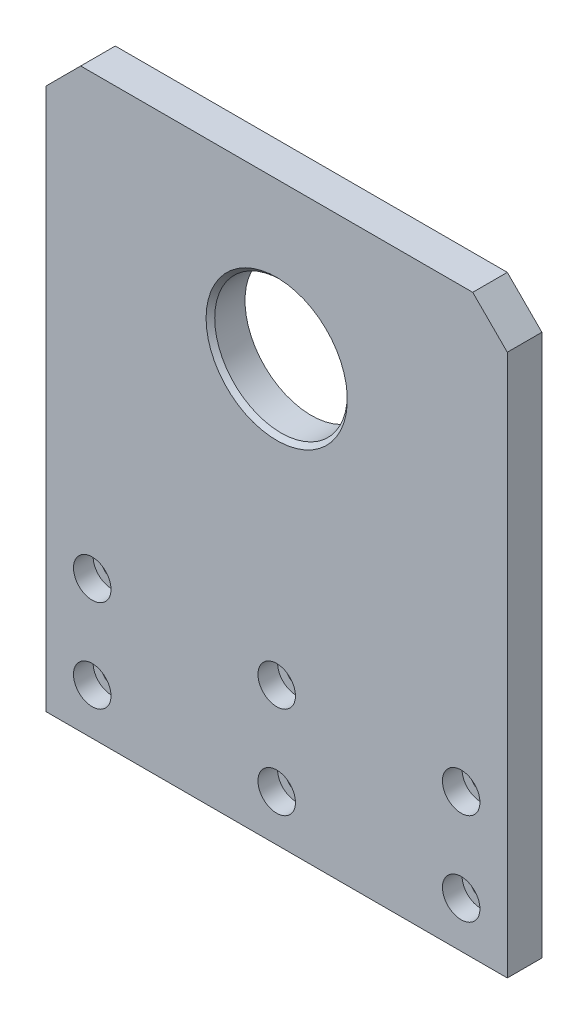
from build123d import *

# Parameters (mm, degrees)
SKETCH1_W                                           = 80
SKETCH1_H                                           = 100
BOSS_EXTRUDE1_DEPTH                                 = 6
CBORE_FOR_M3_HEX_SOCKET_HEAD_CAP_SCREW1_D           = 3.4
CBORE_FOR_M3_HEX_SOCKET_HEAD_CAP_SCREW1_CBORE_D     = 6.5
CBORE_FOR_M3_HEX_SOCKET_HEAD_CAP_SCREW1_CBORE_DEPTH = 3.4
SKETCH4_R                                           = 11.5
CUT_EXTRUDE1_DEPTH                                  = 129.202964084
CHAMFER1_SIZE                                       = 0.75
CHAMFER2_SIZE                                       = 6


with BuildPart() as part:
    # Sketch1 → Boss-Extrude1 (new body)
    with BuildSketch(Plane.XY):
        with Locations((40, 50)):
            Rectangle(SKETCH1_W, SKETCH1_H)
    extrude(amount=BOSS_EXTRUDE1_DEPTH)

    # CBORE for M3 Hex Socket Head Cap Screw1 (through all)
    with Locations(Plane.XY.offset(6)):
        with Locations((8, 8), (40, 8), (72, 8), (40, 24), (72, 24), (8, 24)):
            CounterBoreHole(CBORE_FOR_M3_HEX_SOCKET_HEAD_CAP_SCREW1_D / 2, CBORE_FOR_M3_HEX_SOCKET_HEAD_CAP_SCREW1_CBORE_D / 2, CBORE_FOR_M3_HEX_SOCKET_HEAD_CAP_SCREW1_CBORE_DEPTH)

    # Sketch4 → Cut-Extrude1 (cut, through all)
    with BuildSketch(Plane.XY.offset(6)):
        with Locations((40, 73)):
            Circle(SKETCH4_R)
    extrude(amount=-CUT_EXTRUDE1_DEPTH, mode=Mode.SUBTRACT)

    # Chamfer1
    chamfer1_edges = [part.edges().sort_by_distance(p)[0] for p in [
        (28.5, 73, 6),
    ]]
    chamfer(chamfer1_edges, length=CHAMFER1_SIZE)

    # Chamfer2
    chamfer2_edges = [part.edges().sort_by_distance(p)[0] for p in [
        (0, 100, 3),
        (80, 100, 3),
    ]]
    chamfer(chamfer2_edges, length=CHAMFER2_SIZE)


solid = part.part
